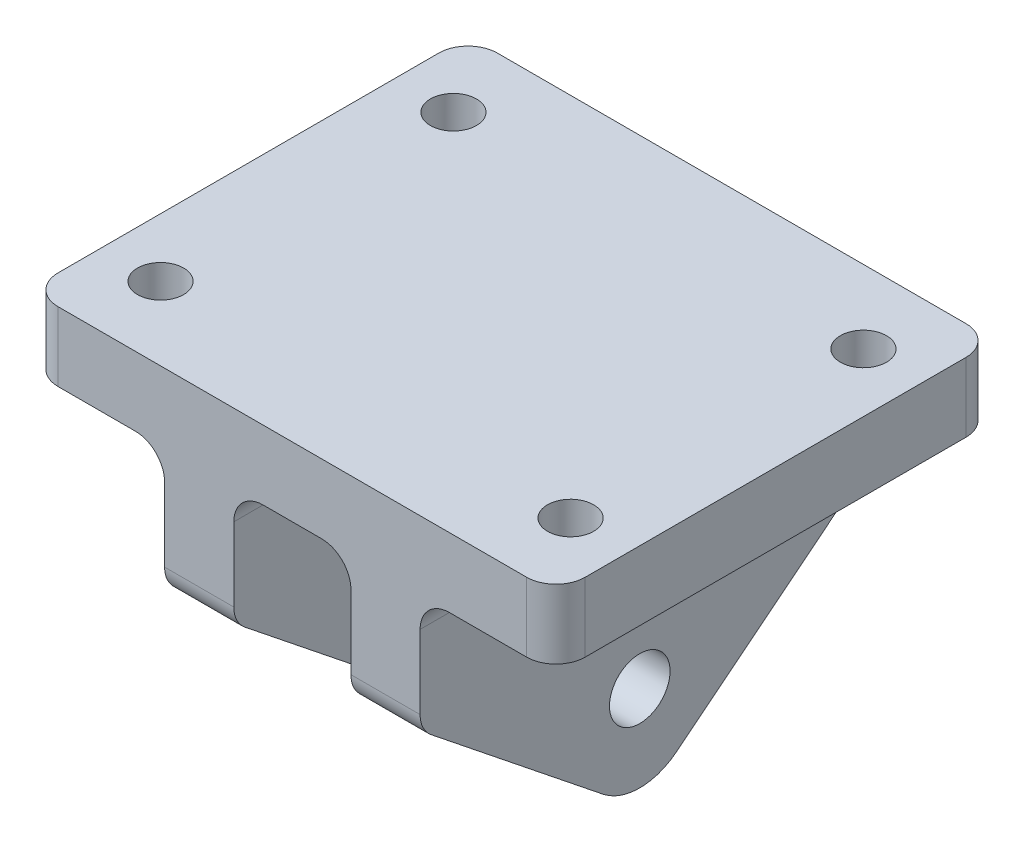
from build123d import *
from OCP.BRepFilletAPI import BRepFilletAPI_MakeFillet

# Parameters (mm, degrees)
SKETCH1_R           = 2.627
BOSS_EXTRUDE1_DEPTH = 6
BOSS_EXTRUDE2_START = -5.08
SKETCH1_3_W         = 38.1
SKETCH1_3_H         = 5.999999938
BOSS_EXTRUDE2_DEPTH = 22.86
SKETCH3_R           = 2.000000064
CUT_EXTRUDE1_DEPTH  = 44.260167546
FILLET1_R1          = 2.54
FILLET1_R2          = 5.08
SKETCH4_R           = 4.2145
SKETCH4_R_2         = 2.627
BOSS_EXTRUDE3_DEPTH = 1.5621
BOSS_EXTRUDE4_START = 8.5979
SKETCH4_2_R         = 4.2145
SKETCH4_2_R_2       = 2.627
BOSS_EXTRUDE4_DEPTH = 1.5621
CHAMFER2_SIZE       = 2.54


with BuildPart() as part:
    # Sketch1 → Boss-Extrude1 (new body)
    with BuildSketch(Plane(origin=(5.08, 0, 0), x_dir=(0, 0, -1), z_dir=(1, 0, 0))):
        Polygon((-19.05, 0), (-19.05, -10.16), (0, -25.4), (19.05, -10.16), (19.05, 0), align=None)
        with Locations((0, -16.51)):
            Circle(SKETCH1_R, mode=Mode.SUBTRACT)
    boss_extrude1 = extrude(amount=BOSS_EXTRUDE1_DEPTH)

    # Sketch1<3> → Boss-Extrude2 (add)
    with BuildSketch(Plane(origin=(5.08, 0, 0), x_dir=(0, 0, -1), z_dir=(1, 0, 0)).offset(BOSS_EXTRUDE2_START)):
        with Locations((0, 2.999999969)):
            Rectangle(SKETCH1_3_W, SKETCH1_3_H)
    boss_extrude2 = extrude(amount=BOSS_EXTRUDE2_DEPTH)

    # Sketch3 → Cut-Extrude1 (cut, through all)
    with BuildSketch(Plane(origin=(0, 5.999999938, 0), x_dir=(1, 0, 0), z_dir=(0, 1, 0))):
        with Locations(Location((17.78, 12.7, 0), (0, 0, 270))):
            Circle(SKETCH3_R)
        with Locations(Location((17.78, -12.7, 0), (0, 0, 90))):
            Circle(SKETCH3_R)
    cut_extrude1 = extrude(amount=-CUT_EXTRUDE1_DEPTH, mode=Mode.SUBTRACT)

    # Mirror2: Boss-Extrude2, Cut-Extrude1 across plane
    add(boss_extrude2.mirror(Plane(origin=(0, 0, 0), x_dir=(0, 0, 1), z_dir=(1, 0, 0))))
    add(cut_extrude1.mirror(Plane(origin=(0, 0, 0), x_dir=(0, 0, 1), z_dir=(1, 0, 0))), mode=Mode.SUBTRACT)

    # Mirror3: Boss-Extrude1 across plane
    add(boss_extrude1.mirror(Plane(origin=(0, 0, 0), x_dir=(0, 0, 1), z_dir=(1, 0, 0))))

    # Fillet1: one fillet with a radius per group of edges: ONE call of the kernel's fillet builder (fillet() takes one radius for all edges)
    fillet1_edges_1 = [part.edges().sort_by_distance(p)[0] for p in [
        (8.08, -10.16, 19.05),
        (8.08, -10.16, -19.05),
        (11.08, 0, 0),
        (22.86, 2.999999969, 19.05),
        (22.86, 2.999999969, -19.05),
        (-22.86, 2.999999969, -19.05),
        (-22.86, 2.999999969, 19.05),
        (-8.08, -10.16, -19.05),
        (-8.08, -10.16, 19.05),
        (-5.08, 0, 0),
        (-11.08, 0, 0),
        (5.08, 0, 0),
    ]]
    fillet1_edges_2 = [part.edges().sort_by_distance(p)[0] for p in [
        (8.08, -25.4, 0),
        (-8.08, -25.4, 0),
    ]]
    fillet1 = BRepFilletAPI_MakeFillet(part.part.solid().wrapped)
    for e in fillet1_edges_1:
        fillet1.Add(FILLET1_R1, e.wrapped)
    for e in fillet1_edges_2:
        fillet1.Add(FILLET1_R2, e.wrapped)
    add(Compound.cast(fillet1.Shape()), mode=Mode.REPLACE)

    # Sketch4 → Boss-Extrude3 (add)
    with BuildSketch(Plane.ZY.offset(-5.08)):
        with Locations(Location((0, -16.51, 0), (0, 0, 180))):
            Circle(SKETCH4_R)
        with Locations((0, -16.51)):
            Circle(SKETCH4_R_2, mode=Mode.SUBTRACT)
    extrude(amount=BOSS_EXTRUDE3_DEPTH)

    # Sketch4<2> → Boss-Extrude4 (add)
    with BuildSketch(Plane.ZY.offset(-5.08).offset(BOSS_EXTRUDE4_START)):
        with Locations(Location((0, -16.51, 0), (0, 0, 180))):
            Circle(SKETCH4_2_R)
        with Locations((0, -16.51)):
            Circle(SKETCH4_2_R_2, mode=Mode.SUBTRACT)
    extrude(amount=BOSS_EXTRUDE4_DEPTH)

    # Chamfer2
    # the kernel refuses this chamfer: 2.54 mm, written as the material it adds along each edge
    with BuildSketch(Plane(origin=(5.08, -16.51, 0), x_dir=(0, 0, -1), z_dir=(0, 1, 0))) as chamfer2_piece_1_section:
        Polygon((4.2145 + CHAMFER2_SIZE, 0), (4.2145, CHAMFER2_SIZE), (4.2145, 0), align=None)
    chamfer2_piece_1 = revolve(axis=Axis((5.08, -16.51, 0), (-1, 0, 0)), mode=Mode.PRIVATE)
    chamfer2_piece_1 = split(chamfer2_piece_1, bisect_by=Plane(origin=(3.5179, -16.51, 5.976913078), z_dir=(1, 0, 0)), keep=Keep.TOP, mode=Mode.PRIVATE)
    add(chamfer2_piece_1)
    with BuildSketch(Plane(origin=(-5.08, -16.51, 0), x_dir=(0, 0, -1), z_dir=(0, 1, 0))) as chamfer2_piece_2_section:
        Polygon((4.2145 + CHAMFER2_SIZE, 0), (4.2145, -CHAMFER2_SIZE), (4.2145, 0), align=None)
    chamfer2_piece_2 = revolve(axis=Axis((-5.08, -16.51, 0), (-1, 0, 0)), mode=Mode.PRIVATE)
    chamfer2_piece_2 = split(chamfer2_piece_2, bisect_by=Plane(origin=(-3.5179, -16.51, 5.976913078), z_dir=(-1, 0, 0)), keep=Keep.TOP, mode=Mode.PRIVATE)
    add(chamfer2_piece_2)


solid = part.part
